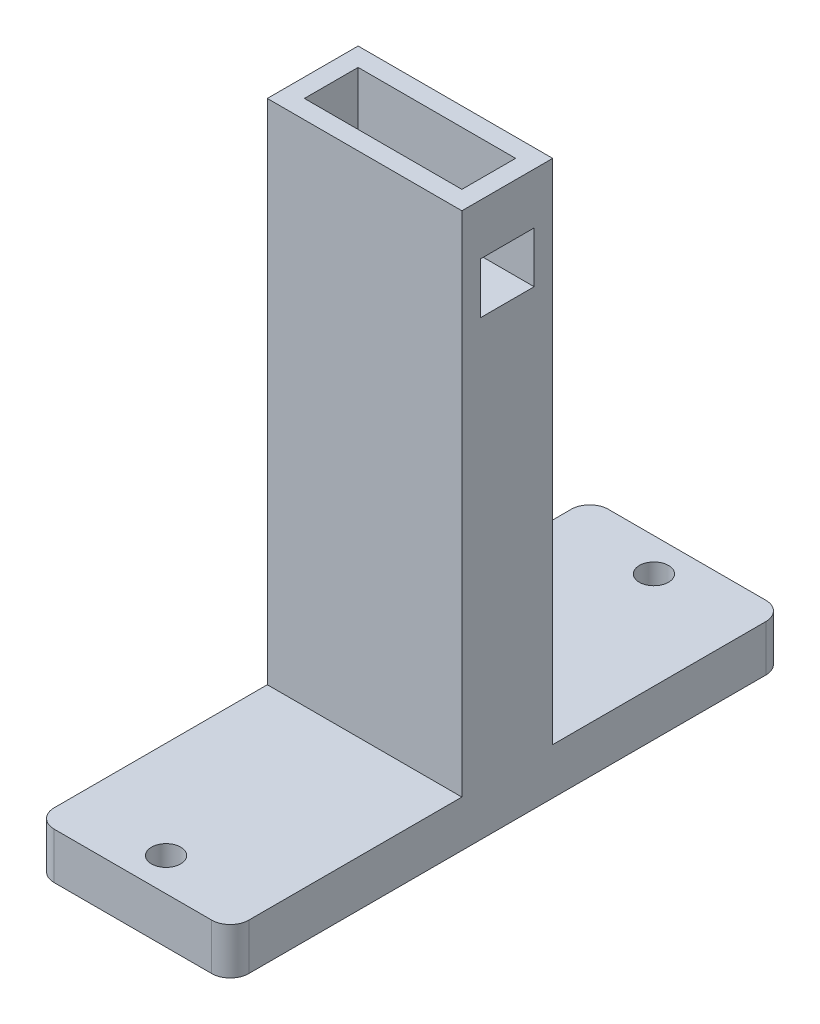
from build123d import *

# Parameters (mm, degrees)
SKETCH1_R             = 2
BOSS_EXTRUDE1_DEPTH   = 6.35
BOSS_EXTRUDE1_2_DEPTH = 6.35
SKETCH1_3_W           = 26.67
SKETCH1_3_H           = 12.446
BOSS_EXTRUDE2_DEPTH   = 61.976
SKETCH2_W             = 26.67
SKETCH2_H             = 12.446
SKETCH2_W_2           = 21.59
SKETCH2_H_2           = 7.366
BOSS_EXTRUDE3_DEPTH   = 13.97
SKETCH3_W             = 7.366
SKETCH3_H             = 6.985
CUT_EXTRUDE1_DEPTH    = 13.97


with BuildPart() as part:
    # Sketch1 → Boss-Extrude1 (new body)
    with BuildSketch(Plane(origin=(0, 0, 0), x_dir=(1, 0, 0), z_dir=(0, 1, 0))):
        with BuildLine():
            Line((-13.335, 6.223), (13.335, 6.223))
            Line((13.335, 6.223), (13.335, 35.433))
            ThreePointArc((13.335, 35.433), (12.591051224, 37.229051224), (10.795, 37.973))
            Line((10.795, 37.973), (-10.795, 37.973))
            ThreePointArc((-10.795, 37.973), (-12.591051224, 37.229051224), (-13.335, 35.433))
            Line((-13.335, 35.433), (-13.335, 6.223))
        make_face()
        with Locations((0, 33.433004)):
            Circle(SKETCH1_R, mode=Mode.SUBTRACT)
    extrude(amount=BOSS_EXTRUDE1_DEPTH)



with BuildPart() as body_2:
    # Sketch1 → Boss-Extrude1 2 (new body)
    with BuildSketch(Plane(origin=(0, 0, 0), x_dir=(1, 0, 0), z_dir=(0, 1, 0))):
        with BuildLine():
            Line((13.335, -35.433), (13.335, -6.223))
            Line((13.335, -6.223), (-13.335, -6.223))
            Line((-13.335, -6.223), (-13.335, -35.433))
            ThreePointArc((-13.335, -35.433), (-12.591051224, -37.229051224), (-10.795, -37.973))
            Line((-10.795, -37.973), (10.795, -37.973))
            ThreePointArc((10.795, -37.973), (12.591051224, -37.229051224), (13.335, -35.433))
        make_face()
        with Locations((0, -33.433004)):
            Circle(SKETCH1_R, mode=Mode.SUBTRACT)
    extrude(amount=BOSS_EXTRUDE1_2_DEPTH)


with BuildPart() as part_1:
    add(part.part)

    add(body_2.part)  # Boss-Extrude2 merges body 2
    # Sketch1<3> → Boss-Extrude2 (add)
    with BuildSketch(Plane(origin=(0, 0, 0), x_dir=(1, 0, 0), z_dir=(0, 1, 0))):
        Rectangle(SKETCH1_3_W, SKETCH1_3_H)
    extrude(amount=BOSS_EXTRUDE2_DEPTH)

    # Sketch2 → Boss-Extrude3 (add)
    with BuildSketch(Plane(origin=(0, 61.976, 0), x_dir=(1, 0, 0), z_dir=(0, 1, 0))):
        Rectangle(SKETCH2_W, SKETCH2_H)
        Rectangle(SKETCH2_W_2, SKETCH2_H_2, mode=Mode.SUBTRACT)
    extrude(amount=BOSS_EXTRUDE3_DEPTH)

    # Sketch3 → Cut-Extrude1 (cut)
    with BuildSketch(Plane(origin=(13.335, 0, 0), x_dir=(0, 0, -1), z_dir=(1, 0, 0))):
        with Locations((0, 65.4685)):
            Rectangle(SKETCH3_W, SKETCH3_H)
    extrude(amount=-CUT_EXTRUDE1_DEPTH, mode=Mode.SUBTRACT)


solid = part_1.part
